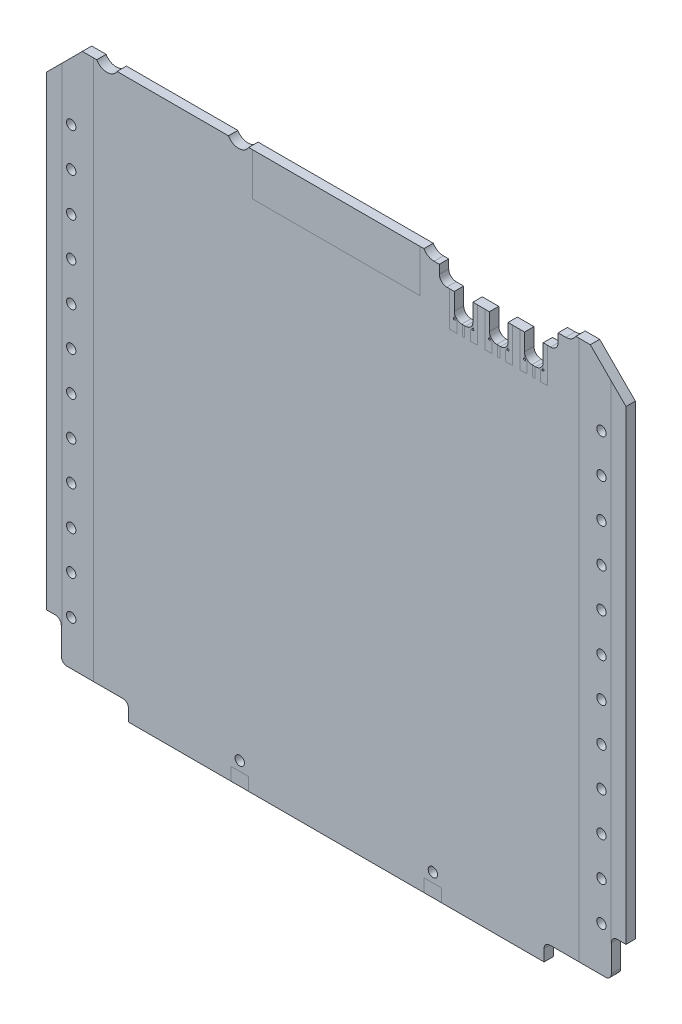
from build123d import *
from build123d.topology import SkipClean

# Parameters (mm, degrees)
SKETCH1_W                        = 99
SKETCH1_H                        = 95.3
BASICSIZE_DEPTH                  = 1.6
CHAMFER1_SIZE                    = 6.1
BACKPLANESIDESCREWCUTOUT_DEPTH   = 71.376203364
LPATTERN3_COUNT                  = 2
LPATTERN3_PITCH                  = 22.5
MIRROR3_COPY_1_DEPTH             = 71.376203364
CUT_EXTRUDE4_DEPTH               = 71.376203364
FILLET1_R                        = 1
FILLET1_OF_MIRROR1_R             = 1
SKETCH7_W                        = 28.575
SKETCH7_H                        = 7.293
TIGEREYEFOOTPRINT_DEPTH          = 0.0001
THERMALCONTACTS_UPPER_W          = 9.492158269
THERMALCONTACTS_UPPER_H          = 86.8
KEEPOUT_BOTTOM_DEPTH             = 0.0001
CAUTION_TOP_START                = -0.00015
CAUTION_TOP_DEPTH                = 0.00015
HOLD_DOWNLOCATIONS_W             = 3
HOLD_DOWNLOCATIONS_H             = 2.2
HOLD_DOWNFOOTPRINTS_DEPTH        = 0.0001
SKETCH10_W                       = 3
SKETCH10_H                       = 3.3
BOTTOMSIDESHELFKEEPOUTS_DEPTH    = 0.0001
SKETCH8_R                        = 0.8
SPRINGPINHOLESEED_DEPTH          = 10
SKETCH11_W                       = 3.18
SKETCH11_H                       = 4.2
CUT_EXTRUDE5_DEPTH               = 10
FILLET2_R                        = 1.27
F_0_32_0_32_DIAMETER_HOLE1_D     = 0.32
F_0_32_0_32_DIAMETER_HOLE1_DEPTH = 9.525
F_0_32_0_32_DIAMETER_HOLE1_TIP   = 0.096137699
SKETCH14_W                       = 0.38
SKETCH14_H                       = 1.79
BOSS_EXTRUDE1_DEPTH              = 0.0001
LPATTERN4_COUNT                  = 3
LPATTERN4_PITCH                  = 6
CUT_EXTRUDE6_DEPTH               = 71.376203364
CUT_EXTRUDE6_DEPTH_BACK          = 71.376203364


# Read off the part's stored shape, not the designer's step: clearances_side-side
with BuildPart() as part:
    # Sketch1 → basicSize (new body)
    with BuildSketch(Plane(origin=(0, 0, -0.0125), x_dir=(-1, 0, 0), z_dir=(0, 0, -1))):
        with Locations((0, -2.35)):
            Rectangle(SKETCH1_W, SKETCH1_H)
    extrude(amount=-BASICSIZE_DEPTH)

    # Chamfer1
    chamfer1_edges = [part.edges().sort_by_distance(p)[0] for p in [
        (49.5, 45.3, 0.7875),
        (-49.5, 45.3, 0.7875),
    ]]
    chamfer(chamfer1_edges, length=CHAMFER1_SIZE)

    # Sketch4 → backplaneSideScrewCutout (cut, symmetric)
    with BuildSketch(Plane.XY.offset(1.5875)):
        with BuildLine():
            Line((37.467949192, 45.3), (40.932050808, 45.3))
            ThreePointArc((40.932050808, 45.3), (39.2, 44.3), (37.467949192, 45.3))
        make_face()
    backplanesidescrewcutout = extrude(amount=BACKPLANESIDESCREWCUTOUT_DEPTH, both=True, mode=Mode.SUBTRACT)

    # LPattern3: backplaneSideScrewCutout ×2
    with Locations(*[(-i * LPATTERN3_PITCH, 0, 0) for i in range(1, LPATTERN3_COUNT)]):
        add(backplanesidescrewcutout, mode=Mode.SUBTRACT)

    # Mirror3: backplaneSideScrewCutout across plane
    add(backplanesidescrewcutout.mirror(Plane(origin=(0, 0, 0), x_dir=(0, 0, 1), z_dir=(1, 0, 0))), mode=Mode.SUBTRACT)

    # Mirror3 copy 1 sketch → Mirror3 copy 1 (cut, symmetric)
    with BuildSketch(Plane(origin=(22.5, 0, 1.5875), x_dir=(-1, 0, 0), z_dir=(0, 0, 1))):
        with BuildLine():
            Line((37.467949192, -45.3), (40.932050808, -45.3))
            ThreePointArc((40.932050808, -45.3), (39.2, -44.3), (37.467949192, -45.3))
        make_face()
    extrude(amount=MIRROR3_COPY_1_DEPTH, both=True, mode=Mode.SUBTRACT)

    # Sketch6 → Cut-Extrude4 (cut, through all)
    with BuildSketch(Plane.XY.offset(1.5875)):
        Polygon((-49.5, -40.4), (-47, -40.4), (-47, -47), (-35.5, -47), (-35.5, -50), (-49.5, -50), align=None)
    cut_extrude4 = extrude(amount=-CUT_EXTRUDE4_DEPTH, mode=Mode.SUBTRACT)

    # Fillet1
    fillet1_edges = [part.edges().sort_by_distance(p)[0] for p in [
        (-47, -40.4, 0.7875),
        (-47, -47, 0.7875),
        (-35.5, -47, 0.7875),
    ]]
    fillet(fillet1_edges, radius=FILLET1_R)

    # Mirror1: Cut-Extrude4 across plane
    add(cut_extrude4.mirror(Plane(origin=(0, 0, 0), x_dir=(0, 0, 1), z_dir=(1, 0, 0))), mode=Mode.SUBTRACT)

    # Fillet1 of Mirror1
    fillet1_of_mirror1_edges = [part.edges().sort_by_distance(p)[0] for p in [
        (47, -40.4, 0.7875),
        (47, -47, 0.7875),
        (35.5, -47, 0.7875),
    ]]
    fillet(fillet1_of_mirror1_edges, radius=FILLET1_OF_MIRROR1_R)

    # Sketch7 → TigerEyeFootprint (cut)
    with BuildSketch(Plane.XY.offset(1.5875)):
        with Locations((0, 41.6535)):
            Rectangle(SKETCH7_W, SKETCH7_H)
    extrude(amount=-TIGEREYEFOOTPRINT_DEPTH, mode=Mode.SUBTRACT)

    # thermalContacts_upper → keepOut_bottom (cut)
    with BuildSketch(Plane.XY.offset(1.5875)):
        with Locations((-51.646079135, 1.9)):
            Rectangle(THERMALCONTACTS_UPPER_W, THERMALCONTACTS_UPPER_H)
    keepout_bottom = extrude(amount=-KEEPOUT_BOTTOM_DEPTH, mode=Mode.SUBTRACT)

    # Sketch3 → caution_top (cut)
    with BuildSketch(Plane.XY.offset(1.5875).offset(CAUTION_TOP_START)):
        with BuildLine():
            Line((-46.9, -41.5), (-47, -41.5))
            Line((-47, -41.5), (-47, -46))
            ThreePointArc((-47, -46), (-46.707106781, -46.707106781), (-46, -47))
            Line((-46, -47), (-41.5, -47))
            Line((-41.5, -47), (-41.5, 45.3))
            Line((-41.5, 45.3), (-46.9, 45.3))
            Line((-46.9, 45.3), (-46.9, -41.5))
        make_face()
    caution_top = extrude(amount=CAUTION_TOP_DEPTH, mode=Mode.SUBTRACT)

    # hold-downLocations → hold-downFootprints (cut)
    with BuildSketch(Plane.XY.offset(1.5875)):
        with Locations((16.5, -48.9)):
            Rectangle(HOLD_DOWNLOCATIONS_W, HOLD_DOWNLOCATIONS_H)
    hold_downfootprints = extrude(amount=-HOLD_DOWNFOOTPRINTS_DEPTH, mode=Mode.SUBTRACT)

    # clearances_top-bottom: keepOut_bottom, caution_top, hold-downFootprints across plane
    add(keepout_bottom.mirror(Plane.XY.offset(0.7875)), mode=Mode.SUBTRACT)
    add(caution_top.mirror(Plane.XY.offset(0.7875)), mode=Mode.SUBTRACT)
    add(hold_downfootprints.mirror(Plane.XY.offset(0.7875)), mode=Mode.SUBTRACT)

    # clearances_side-side: part across plane


with BuildPart() as part_1:
    add(part.part)
    add(part.part.mirror(Plane(origin=(0, 0, 0), x_dir=(0, 0, 1), z_dir=(1, 0, 0))))

    # Sketch10 → bottomsideShelfKeepouts (cut)
    with BuildSketch(Plane(origin=(0, 0, -0.0125), x_dir=(-1, 0, 0), z_dir=(0, 0, -1))):
        with Locations((-16.5, -46.15)):
            Rectangle(SKETCH10_W, SKETCH10_H)
        with Locations((16.5, -46.15)):
            Rectangle(SKETCH10_W, SKETCH10_H)
    extrude(amount=-BOTTOMSIDESHELFKEEPOUTS_DEPTH, mode=Mode.SUBTRACT)

    # Sketch8 → springPinHoleSeed (cut)
    with BuildSketch(Plane.XY.offset(1.5875)):
        with Locations((-45.3, 33.5)):
            Circle(SKETCH8_R)
        with Locations((-45.3, 26.872727273)):
            Circle(SKETCH8_R)
        with Locations((-45.3, 20.245454545)):
            Circle(SKETCH8_R)
        with Locations((-45.3, 13.618181818)):
            Circle(SKETCH8_R)
        with Locations((-45.3, 6.990909091)):
            Circle(SKETCH8_R)
        with Locations((-45.3, 0.363636364)):
            Circle(SKETCH8_R)
        with Locations((-45.3, -6.263636364)):
            Circle(SKETCH8_R)
        with Locations((-45.3, -12.890909091)):
            Circle(SKETCH8_R)
        with Locations((-45.3, -19.518181818)):
            Circle(SKETCH8_R)
        with Locations((-45.3, -26.145454545)):
            Circle(SKETCH8_R)
        with Locations((-45.3, -32.772727273)):
            Circle(SKETCH8_R)
        with Locations((-45.3, -39.4)):
            Circle(SKETCH8_R)
        with Locations((-16.5, -46.2)):
            Circle(SKETCH8_R)
    springpinholeseed = extrude(amount=-SPRINGPINHOLESEED_DEPTH, mode=Mode.SUBTRACT)

    # Mirror4: springPinHoleSeed across plane
    add(springpinholeseed.mirror(Plane(origin=(0, 0, 0), x_dir=(0, 0, 1), z_dir=(1, 0, 0))), mode=Mode.SUBTRACT)

    # Sketch11 → Cut-Extrude5 (cut)
    with BuildSketch(Plane.XY.offset(1.5875)):
        with Locations((33.75, 39.46)):
            Rectangle(SKETCH11_W, SKETCH11_H)
        with Locations((27.75, 39.46)):
            Rectangle(SKETCH11_W, SKETCH11_H)
        with Locations((21.75, 39.46)):
            Rectangle(SKETCH11_W, SKETCH11_H)
    extrude(amount=-CUT_EXTRUDE5_DEPTH, mode=Mode.SUBTRACT)

    # Fillet2
    fillet2_edges = [part_1.edges().sort_by_distance(p)[0] for p in [
        (35.34, 37.36, 0.7875),
        (32.16, 37.36, 0.7875),
        (29.34, 37.36, 0.7875),
        (26.16, 37.36, 0.7875),
        (23.34, 37.36, 0.7875),
        (20.16, 37.36, 0.7875),
    ]]
    fillet(fillet2_edges, radius=FILLET2_R)

    # Ø0.32 (0.32) Diameter Hole1
    with Locations(Plane.XY.offset(1.5875)):
        with Locations((35.34, 37.52), (32.16, 37.52), (29.34, 37.52), (26.16, 37.52), (23.34, 37.52), (20.16, 37.52)):
            Hole(F_0_32_0_32_DIAMETER_HOLE1_D / 2, depth=F_0_32_0_32_DIAMETER_HOLE1_DEPTH)
            with Locations((0, 0, -(F_0_32_0_32_DIAMETER_HOLE1_DEPTH + F_0_32_0_32_DIAMETER_HOLE1_TIP / 2))):  # 118° drill point
                Cone(0, F_0_32_0_32_DIAMETER_HOLE1_D / 2, F_0_32_0_32_DIAMETER_HOLE1_TIP, mode=Mode.SUBTRACT)

    # Sketch14 → Boss-Extrude1 (add)
    with SkipClean():  # the faces are left unmerged after this step: merging them gives an invalid solid
        with BuildSketch(Plane.XY.offset(1.5875)):
            with BuildLine():
                ThreePointArc((32.16, 37.68), (32, 37.52), (32.16, 37.36))
                Line((32.16, 37.36), (32.605, 37.36))
                Line((32.605, 37.36), (32.605, 35.57))
                Line((32.605, 35.57), (31.375, 35.57))
                Line((31.375, 35.57), (31.375, 41.56))
                Line((31.375, 41.56), (32.16, 41.56))
                Line((32.16, 41.56), (32.16, 38.63))
                Line((32.16, 38.63), (32.16, 37.68))
            make_face()
            with Locations((33.75, 36.465)):
                Rectangle(SKETCH14_W, SKETCH14_H)
            with BuildLine():
                ThreePointArc((35.34, 37.36), (35.5, 37.52), (35.34, 37.68))
                Line((35.34, 37.68), (35.34, 38.63))
                Line((35.34, 38.63), (35.34, 41.56))
                Line((35.34, 41.56), (36.125, 41.56))
                Line((36.125, 41.56), (36.125, 35.57))
                Line((36.125, 35.57), (34.895, 35.57))
                Line((34.895, 35.57), (34.895, 37.36))
                Line((34.895, 37.36), (35.34, 37.36))
            make_face()
        boss_extrude1 = extrude(amount=BOSS_EXTRUDE1_DEPTH)
    add(part_1.part.scale(1), mode=Mode.REPLACE)  # the faces are merged on a copy

    # LPattern4: Boss-Extrude1 ×3
    with Locations(*[(-i * LPATTERN4_PITCH, 0, 0) for i in range(1, LPATTERN4_COUNT)]):
        add(boss_extrude1)

    # Sketch15 → Cut-Extrude6 (cut, two sides: drawn at the far end of the back side and taken through both)
    with BuildSketch(Plane.XY.offset(1.5875).offset(-CUT_EXTRUDE6_DEPTH_BACK)):
        with BuildLine():
            Line((17.605, 45.3), (37.895, 45.3))
            Line((37.895, 45.3), (39.2, 45.3))
            Line((39.2, 45.3), (39.2, 44.3))
            Line((39.2, 44.3), (37.895, 44.3))
            Line((37.895, 44.3), (37.895, 42.83))
            ThreePointArc((37.895, 42.83), (37.523025612, 41.931974388), (36.625, 41.56))
            Line((36.625, 41.56), (18.875, 41.56))
            ThreePointArc((18.875, 41.56), (17.976974388, 41.931974388), (17.605, 42.83))
            Line((17.605, 42.83), (17.605, 44.3))
            Line((17.605, 44.3), (16.7, 44.3))
            Line((16.7, 44.3), (16.7, 45.3))
            Line((16.7, 45.3), (17.605, 45.3))
        make_face()
    extrude(amount=CUT_EXTRUDE6_DEPTH + CUT_EXTRUDE6_DEPTH_BACK, mode=Mode.SUBTRACT)


solid = part_1.part
